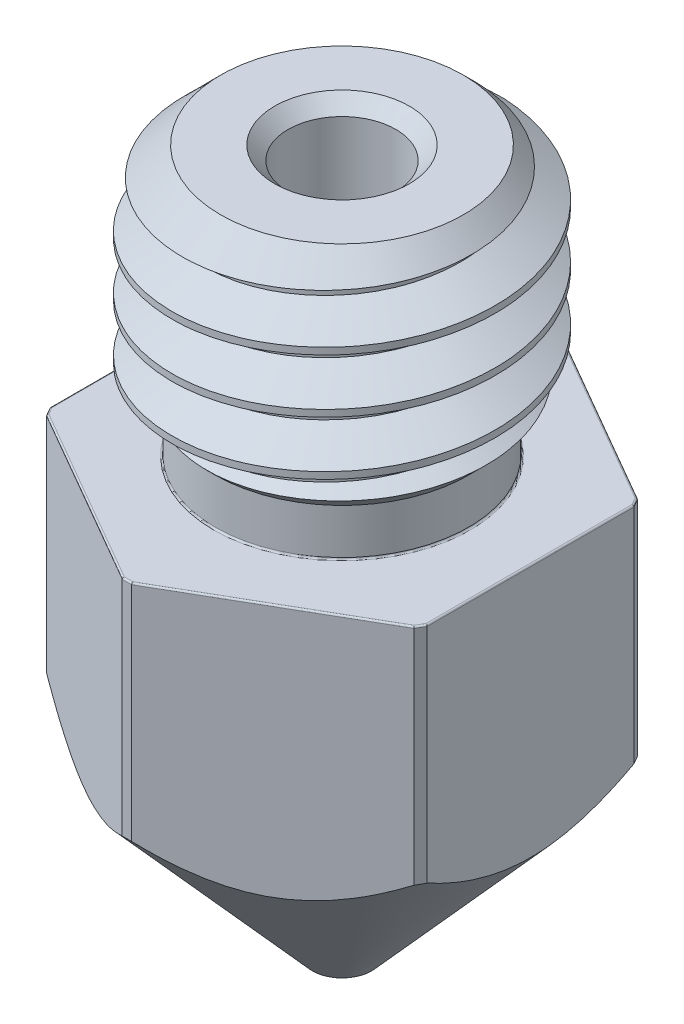
from build123d import *

# Parameters (mm, degrees)
BOSS_EXTRUDE1_DEPTH = 8
SKETCH5_R           = 3
BOSS_EXTRUDE2_DEPTH = 5
SKETCH10_OUTSIDE_W  = 12.366
SKETCH10_OUTSIDE_H  = 13.448
SKETCH10_OUTSIDE_R  = 3.991451884
CUT_EXTRUDE1_DEPTH  = 10.622023349
CHAMFER5_SIZE       = 0.25
CHAMFER1_SIZE       = 0.75
CUT_SWEEP1_PITCH    = 1
FILLET1_R           = 0.03


with BuildPart() as part:
    # Sketch3 → Boss-Extrude1 (new body)
    with BuildSketch(Plane(origin=(0, 0, 0), x_dir=(1, 0, 0), z_dir=(0, 1, 0))):
        Polygon((0, 4.041451884), (-3.5, 2.020725942), (-3.5, -2.020725942), (0, -4.041451884), (3.5, -2.020725942), (3.5, 2.020725942), align=None)
    extrude(amount=-BOSS_EXTRUDE1_DEPTH)

    # Sketch4 → Cut-Revolve1 (revolve, cut)
    with BuildSketch(Plane(origin=(0, 0, 0), x_dir=(0.8660254037844385, 0, -0.5000000000000004), z_dir=(0.5000000000000004, 0, 0.8660254037844385)), mode=Mode.PRIVATE) as cut_revolve1_sk:
        Polygon((0.550982682, -8), (4.041451884, -4.1), (4.041451884, -8), align=None)
    revolve(cut_revolve1_sk.sketch.rotate(Axis((0, 5, 0), (0, -1, 0)), 210), axis=Axis((0, 5, 0), (0, -1, 0)), mode=Mode.SUBTRACT)


with BuildPart() as body_2:
    # Sketch5 → Boss-Extrude2 (new body)
    with BuildSketch(Plane(origin=(0, 0, 0), x_dir=(1, 0, 0), z_dir=(0, 1, 0))):
        with Locations(Location((0, 0, 0), (0, 0, 270))):
            Circle(SKETCH5_R)
    extrude(amount=BOSS_EXTRUDE2_DEPTH)


with BuildPart() as cut_revolve3_tool:
    # Sketch9 → Cut-Revolve3 (revolve)
    with BuildSketch(Plane.XY):
        Polygon((1, -6.160769515), (1, 5), (0, 5), (0, -8), (0.4, -8), (0.4, -7.2), align=None)
    revolve(axis=Axis((0, 5, 0), (0, -1, 0)))


with BuildPart() as part_1:
    add(part.part)

    # Cut-Revolve3: cut by cut_revolve3_tool
    add(cut_revolve3_tool.part, mode=Mode.SUBTRACT)

    # Sketch10 outside → Cut-Extrude1 (cut, through all)
    with BuildSketch(Plane(origin=(0, 0, 0), x_dir=(1, 0, 0), z_dir=(0, 1, 0))):
        Rectangle(SKETCH10_OUTSIDE_W, SKETCH10_OUTSIDE_H)
        Circle(SKETCH10_OUTSIDE_R, mode=Mode.SUBTRACT)
    extrude(amount=-CUT_EXTRUDE1_DEPTH, mode=Mode.SUBTRACT)


with BuildPart() as body_2_1:
    add(body_2.part)

    # Cut-Revolve3: cut by cut_revolve3_tool
    add(cut_revolve3_tool.part, mode=Mode.SUBTRACT)

    # Chamfer5
    chamfer5_edges = [body_2_1.edges().sort_by_distance(p)[0] for p in [
        (1, 5, 0),
    ]]
    chamfer(chamfer5_edges, length=CHAMFER5_SIZE)

    # Chamfer1
    chamfer1_edges = [body_2_1.edges().sort_by_distance(p)[0] for p in [
        (0, 5, -3),
    ]]
    chamfer(chamfer1_edges, length=CHAMFER1_SIZE)

    # Cut-Sweep1: the profile of Sketch7 screwed along a right-hand helix of 6 turns, 8 arcs to a turn; built about Z, then put on its axis
    cut_sweep1_z = Axis((0, 0, 0), (0, 0, 1))
    cut_sweep1_corners = [(3, 0, 0), (2.350480947, 0, -0.375), (2.350480947, 0, -0.5), (3, 0, -0.875), (3.127, 0, -0.948323484), (3.127, 0, 0.073323484)]
    with BuildLine(mode=Mode.PRIVATE) as cut_sweep1_profile:
        Line(cut_sweep1_corners[0], cut_sweep1_corners[1])
        Line(cut_sweep1_corners[1], cut_sweep1_corners[2])
        Line(cut_sweep1_corners[2], cut_sweep1_corners[3])
        Line(cut_sweep1_corners[3], cut_sweep1_corners[4])
        Line(cut_sweep1_corners[4], cut_sweep1_corners[5])
        Line(cut_sweep1_corners[5], cut_sweep1_corners[0])
    cut_sweep1_cap = Face(cut_sweep1_profile.wire())
    cut_sweep1_turn_angles = [0, 22.5, 45, 67.5, 90, 112.5, 135, 157.5, 180, 202.5, 225, 247.5, 270, 292.5, 315, 337.5, 360]
    cut_sweep1_turn_weights = [1, 0.9238795325112867, 1, 0.9238795325112867, 1, 0.9238795325112867, 1, 0.9238795325112867, 1, 0.9238795325112867, 1, 0.9238795325112867, 1, 0.9238795325112867, 1, 0.9238795325112867, 1]
    cut_sweep1_turn_rails = [Edge.make_bspline([Vector(p[0], p[1], 0).rotate(cut_sweep1_z, cut_sweep1_turn_angles[k]) / cut_sweep1_turn_weights[k] + Vector(0, 0, p[2] + CUT_SWEEP1_PITCH * cut_sweep1_turn_angles[k] / 360) for k in range(17)], [0, 0, 0, 1, 1, 2, 2, 3, 3, 4, 4, 5, 5, 6, 6, 7, 7, 8, 8, 8], 2, cut_sweep1_turn_weights) for p in cut_sweep1_corners]
    cut_sweep1_turn_sides = [Face.make_surface_from_curves(cut_sweep1_turn_rails[p[0]], cut_sweep1_turn_rails[p[1]]) for p in [(0, 1), (1, 2), (2, 3), (3, 4), (4, 5), (5, 0)]]
    cut_sweep1 = Plane(origin=(0, 5, 0), x_dir=(1, 0, 0), z_dir=(0, -1, 0)) * Solid(Shell([*[p.moved(Location((0, 0, CUT_SWEEP1_PITCH * i))) for i in range(6) for p in cut_sweep1_turn_sides], cut_sweep1_cap, cut_sweep1_cap.rotate(cut_sweep1_z, 2160).moved(Location((0, 0, CUT_SWEEP1_PITCH * 2160 / 360)))]))
    add(cut_sweep1, mode=Mode.SUBTRACT)

    # Sketch8 → Cut-Revolve2 (revolve, cut)
    with BuildSketch(Plane.XY, mode=Mode.PRIVATE) as cut_revolve2_sk:
        Polygon((2.350480947, 0), (3, 0), (3, 1.516669053), (2.350480947, 0.86715), align=None)
    revolve(cut_revolve2_sk.sketch.rotate(Axis((0, 5, 0), (0, -1, 0)), 227.950665687), axis=Axis((0, 5, 0), (0, -1, 0)), mode=Mode.SUBTRACT)

    # Combine1: union part
    add(part_1.part)

    # Fillet1
    fillet1_edges = [body_2_1.edges().sort_by_distance(p)[0] for p in [
        (2.349701768, 0, 0.060516823),
        (1.75, 0, 3.031088913),
        (3.45669873, 0, 1.995725942),
        (3.5, 0, 0),
        (3.45669873, 0, -1.995725942),
        (1.75, 0, -3.031088913),
        (0, 0, -3.991451884),
        (-1.75, 0, -3.031088913),
        (-3.45669873, 0, -1.995725942),
        (-3.5, 0, 0),
        (-3.45669873, 0, 1.995725942),
        (-1.75, 0, 3.031088913),
        (0, 0, 3.991451884),
    ]]
    fillet(fillet1_edges, radius=FILLET1_R)


solid = body_2_1.part
